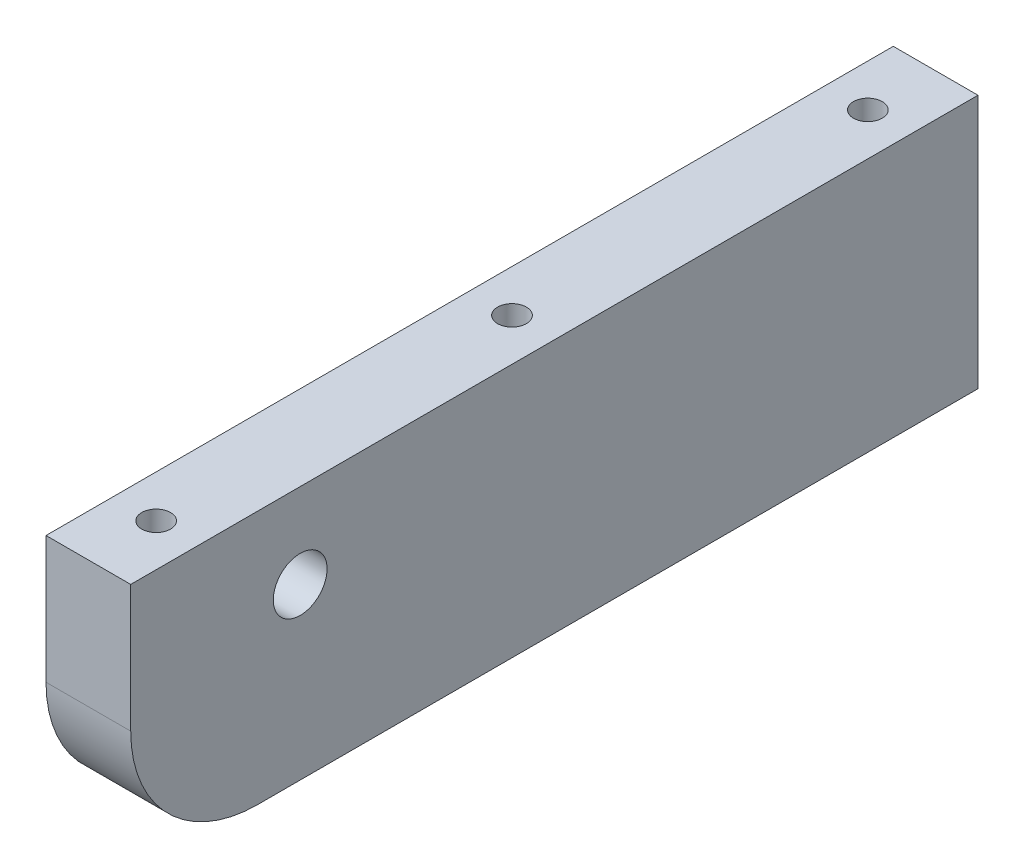
from build123d import *

# Parameters (mm, degrees)
SKETCH1_W                     = 100
SKETCH1_H                     = 30
SKETCH1_R                     = 3.175
BOSS_EXTRUDE1_DEPTH           = 10
FILLET1_R                     = 15
CBORE_FOR_M3_SHCS_D           = 3.4
CBORE_FOR_M3_SHCS_DEPTH       = 23
CBORE_FOR_M3_SHCS_CBORE_D     = 6.5
CBORE_FOR_M3_SHCS_CBORE_DEPTH = 3
CBORE_FOR_M3_SHCS_TIP         = 1.021463052


with BuildPart() as part:
    # Sketch1 → Boss-Extrude1 (new body)
    with BuildSketch(Plane(origin=(0, 0, 0), x_dir=(0, 0, -1), z_dir=(1, 0, 0))):
        Rectangle(SKETCH1_W, SKETCH1_H)
        with Locations((-30, 5)):
            Circle(SKETCH1_R, mode=Mode.SUBTRACT)
    extrude(amount=BOSS_EXTRUDE1_DEPTH)

    # Fillet1
    fillet1_edges = [part.edges().sort_by_distance(p)[0] for p in [
        (5, -15, 50),
    ]]
    fillet(fillet1_edges, radius=FILLET1_R)

    # CBORE for M3 SHCS
    with Locations(Plane(origin=(-616.293536786, 25, -1323.282701689), x_dir=(1, 0, 0), z_dir=(0, 1, 0))):
        with Locations((731.293536786, -1281.282701689), (731.293536786, -1343.282701689), (621.293536786, -1281.282701689), (621.293536786, -1365.282701689), (621.293536786, -1323.282701689), (731.293536786, -1312.282701689)):
            CounterBoreHole(CBORE_FOR_M3_SHCS_D / 2, CBORE_FOR_M3_SHCS_CBORE_D / 2, CBORE_FOR_M3_SHCS_CBORE_DEPTH, depth=CBORE_FOR_M3_SHCS_DEPTH)
            with Locations((0, 0, -(CBORE_FOR_M3_SHCS_DEPTH + CBORE_FOR_M3_SHCS_TIP / 2))):  # 118° drill point
                Cone(0, CBORE_FOR_M3_SHCS_D / 2, CBORE_FOR_M3_SHCS_TIP, mode=Mode.SUBTRACT)


solid = part.part
